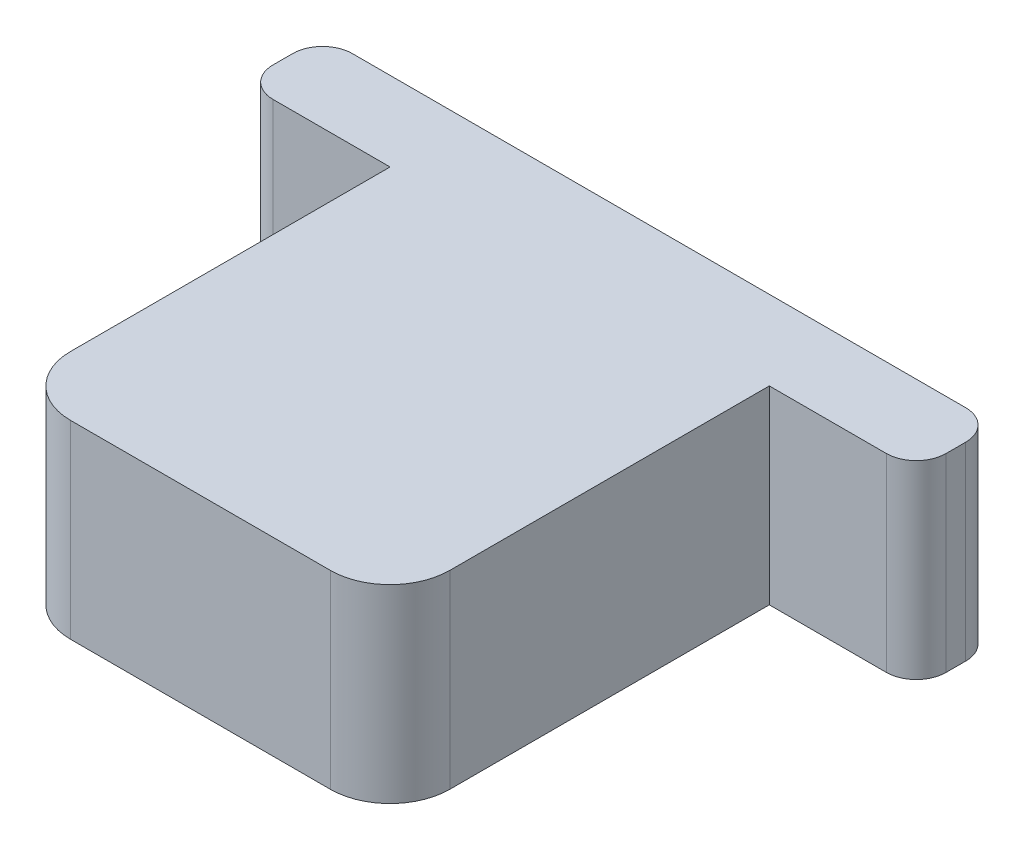
from build123d import *

# Parameters (mm, degrees)
BOSS_EXTRUDE1_DEPTH = 3.175
FILLET1_R           = 1
FILLET2_R           = 0.5


with BuildPart() as part:
    # Sketch1 → Boss-Extrude1 (new body)
    with BuildSketch(Plane(origin=(0, 0, 0), x_dir=(1, 0, 0), z_dir=(0, 1, 0))):
        Polygon((0, 0), (6.35, 0), (6.35, 6.35), (8.81, 6.35), (8.81, 7.6787274), (-2.46, 7.6787274), (-2.46, 6.35), (0, 6.35), align=None)
    extrude(amount=BOSS_EXTRUDE1_DEPTH)

    # Fillet1
    fillet1_edges = [part.edges().sort_by_distance(p)[0] for p in [
        (0, 1.5875, 0),
        (6.35, 1.5875, 0),
    ]]
    fillet(fillet1_edges, radius=FILLET1_R)

    # Fillet2
    fillet2_edges = [part.edges().sort_by_distance(p)[0] for p in [
        (-2.46, 1.5875, -6.35),
        (-2.46, 1.5875, -7.6787274),
        (8.81, 1.5875, -7.6787274),
        (8.81, 1.5875, -6.35),
    ]]
    fillet(fillet2_edges, radius=FILLET2_R)


solid = part.part
